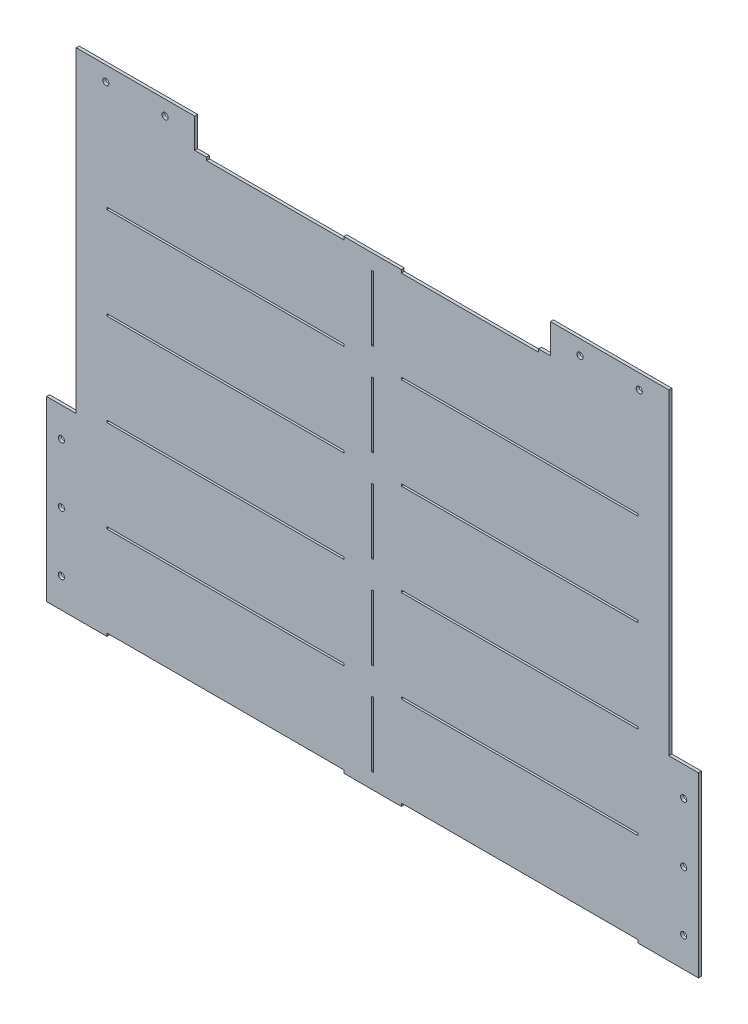
from build123d import *

# Parameters (mm, degrees)
MASTER_SKETCH_W         = 635.3556
MASTER_SKETCH_H         = 498.348
BOSS_EXTRUDE1_DEPTH     = 3.175
SKETCH2_W               = 31.75
SKETCH2_H               = 190.5
BOSS_EXTRUDE2_DEPTH     = 3.175
M6_CLEARANCE_HOLE1_D    = 6.6
SKETCH5_W               = 2.286
SKETCH5_H               = 69.85
CUT_EXTRUDE1_DEPTH      = 430.182420788
LPATTERN1_COUNT         = 5
LPATTERN1_PITCH         = 98.8568
SKETCH7_W               = 254
SKETCH7_H               = 2.286
CUT_EXTRUDE3_DEPTH      = 430.182420788
LPATTERN2_COUNT         = 4
LPATTERN2_PITCH         = 98.8568
MIRROR4_COPY_1_SKETCH_W = 254
MIRROR4_COPY_1_SKETCH_H = 2.286
MIRROR4_COPY_1_DEPTH    = 430.182420788
MIRROR4_COPY_2_SKETCH_W = 254
MIRROR4_COPY_2_SKETCH_H = 2.286
MIRROR4_COPY_2_DEPTH    = 430.182420788
MIRROR4_COPY_3_SKETCH_W = 254
MIRROR4_COPY_3_SKETCH_H = 2.286
MIRROR4_COPY_3_DEPTH    = 430.182420788
SKETCH10_W              = 127
SKETCH10_H              = 31.75
BOSS_EXTRUDE3_DEPTH     = 3.175
M6_CLEARANCE_HOLE2_D    = 6.6
SKETCH6_W               = 147.1549
SKETCH6_H               = 3.175
SKETCH6_W_2             = 254
CUT_EXTRUDE2_DEPTH      = 449.361641774


with BuildPart() as part:
    # Master Sketch → Boss-Extrude1 (new body)
    with BuildSketch(Plane.XY):
        Rectangle(MASTER_SKETCH_W, MASTER_SKETCH_H)
    extrude(amount=BOSS_EXTRUDE1_DEPTH)

    # Sketch2 → Boss-Extrude2 (add)
    with BuildSketch(Plane.XY.offset(3.175)):
        with Locations((-333.5528, -153.924)):
            Rectangle(SKETCH2_W, SKETCH2_H)
    boss_extrude2 = extrude(amount=-BOSS_EXTRUDE2_DEPTH)

    # M6 Clearance Hole1 (through all)
    with Locations(Plane.XY.offset(3.175)):
        with Locations((-333.5528, -90.424), (-333.5528, -153.924), (-333.5528, -217.424)):
            m6_clearance_hole1 = Hole(M6_CLEARANCE_HOLE1_D / 2)

    # Mirror1: Boss-Extrude2, M6 Clearance Hole1 across plane
    add(boss_extrude2.mirror(Plane(origin=(0, 0, 0), x_dir=(0, 0, 1), z_dir=(1, 0, 0))))
    add(m6_clearance_hole1.mirror(Plane(origin=(0, 0, 0), x_dir=(0, 0, 1), z_dir=(1, 0, 0))), mode=Mode.SUBTRACT)

    # Sketch5 → Cut-Extrude1 (cut, through all)
    with BuildSketch(Plane.XY.offset(3.175)):
        with Locations((0, 197.7136)):
            Rectangle(SKETCH5_W, SKETCH5_H)
    cut_extrude1 = extrude(amount=-CUT_EXTRUDE1_DEPTH, mode=Mode.SUBTRACT)

    # LPattern1: Cut-Extrude1 ×5
    with Locations(*[(0, -i * LPATTERN1_PITCH, 0) for i in range(1, LPATTERN1_COUNT)]):
        add(cut_extrude1, mode=Mode.SUBTRACT)

    # Sketch7 → Cut-Extrude3 (cut, through all)
    with BuildSketch(Plane.XY.offset(3.175)):
        with Locations((-157.8229, 148.2852)):
            Rectangle(SKETCH7_W, SKETCH7_H)
    cut_extrude3 = extrude(amount=-CUT_EXTRUDE3_DEPTH, mode=Mode.SUBTRACT)

    # LPattern2: Cut-Extrude3 ×4
    with Locations(*[(0, -i * LPATTERN2_PITCH, 0) for i in range(1, LPATTERN2_COUNT)]):
        add(cut_extrude3, mode=Mode.SUBTRACT)

    # Mirror4: Cut-Extrude3 across plane
    add(cut_extrude3.mirror(Plane(origin=(0, 0, 0), x_dir=(0, 0, 1), z_dir=(1, 0, 0))), mode=Mode.SUBTRACT)

    # Mirror4 copy 1 sketch → Mirror4 copy 1 (cut, through all)
    with BuildSketch(Plane(origin=(0, -98.8568, 3.175), x_dir=(-1, 0, 0), z_dir=(0, 0, 1))):
        with Locations((-157.8229, -148.2852)):
            Rectangle(MIRROR4_COPY_1_SKETCH_W, MIRROR4_COPY_1_SKETCH_H)
    extrude(amount=-MIRROR4_COPY_1_DEPTH, mode=Mode.SUBTRACT)

    # Mirror4 copy 2 sketch → Mirror4 copy 2 (cut, through all)
    with BuildSketch(Plane(origin=(0, -197.7136, 3.175), x_dir=(-1, 0, 0), z_dir=(0, 0, 1))):
        with Locations((-157.8229, -148.2852)):
            Rectangle(MIRROR4_COPY_2_SKETCH_W, MIRROR4_COPY_2_SKETCH_H)
    extrude(amount=-MIRROR4_COPY_2_DEPTH, mode=Mode.SUBTRACT)

    # Mirror4 copy 3 sketch → Mirror4 copy 3 (cut, through all)
    with BuildSketch(Plane(origin=(0, -296.5704, 3.175), x_dir=(-1, 0, 0), z_dir=(0, 0, 1))):
        with Locations((-157.8229, -148.2852)):
            Rectangle(MIRROR4_COPY_3_SKETCH_W, MIRROR4_COPY_3_SKETCH_H)
    extrude(amount=-MIRROR4_COPY_3_DEPTH, mode=Mode.SUBTRACT)

    # Sketch10 → Boss-Extrude3 (add)
    with BuildSketch(Plane.XY.offset(3.175)):
        with Locations((-254.1778, 265.049)):
            Rectangle(SKETCH10_W, SKETCH10_H)
    boss_extrude3 = extrude(amount=-BOSS_EXTRUDE3_DEPTH)

    # M6 Clearance Hole2 (through all)
    with Locations(Plane.XY.offset(3.175)):
        with Locations((-285.9278, 265.049), (-222.4278, 265.049)):
            m6_clearance_hole2 = Hole(M6_CLEARANCE_HOLE2_D / 2)

    # Mirror6: Boss-Extrude3, M6 Clearance Hole2 across plane
    add(boss_extrude3.mirror(Plane(origin=(0, 0, 0), x_dir=(0, 0, 1), z_dir=(1, 0, 0))))
    add(m6_clearance_hole2.mirror(Plane(origin=(0, 0, 0), x_dir=(0, 0, 1), z_dir=(1, 0, 0))), mode=Mode.SUBTRACT)

    # Sketch6 → Cut-Extrude2 (cut, through all)
    with BuildSketch(Plane.XY.offset(3.175)):
        with Locations((-104.40035, 247.5865)):
            Rectangle(SKETCH6_W, SKETCH6_H)
        with Locations((104.40035, 247.5865)):
            Rectangle(SKETCH6_W, SKETCH6_H)
        with Locations((157.8229, -247.5865)):
            Rectangle(SKETCH6_W_2, SKETCH6_H)
        with Locations((-157.8229, -247.5865)):
            Rectangle(SKETCH6_W_2, SKETCH6_H)
    extrude(amount=-CUT_EXTRUDE2_DEPTH, mode=Mode.SUBTRACT)


solid = part.part
